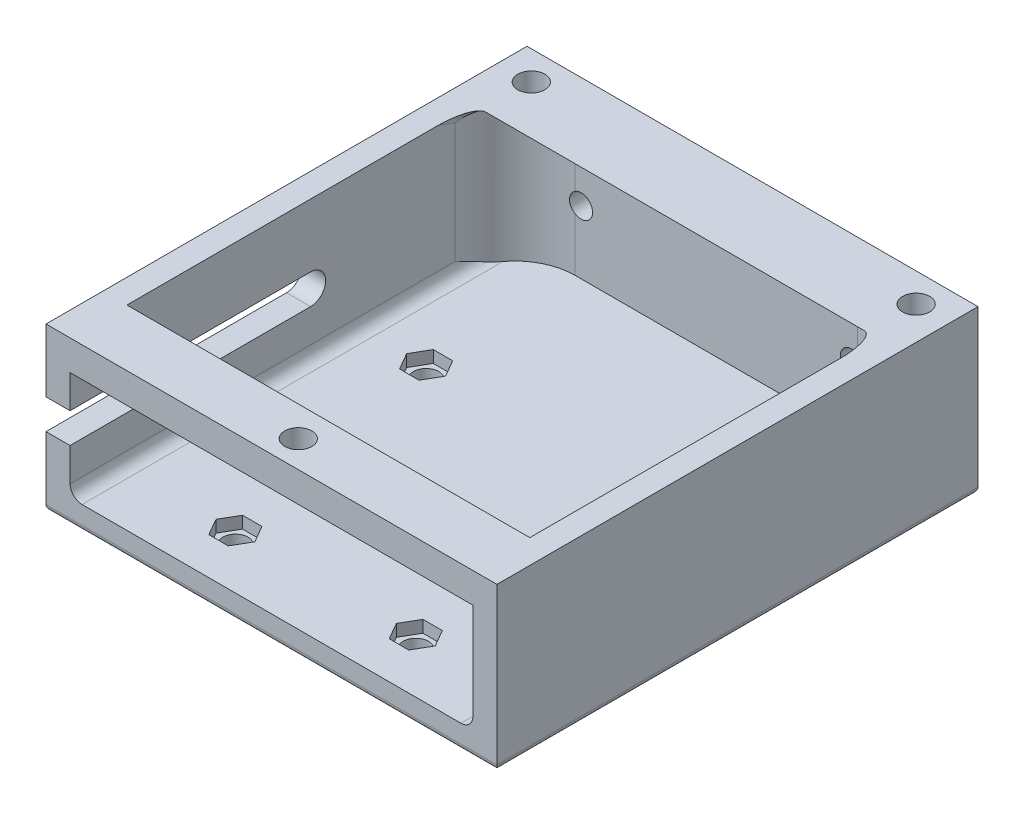
from build123d import *

# Parameters (mm, degrees)
EXTRUDE_1_DEPTH          = 37.5
SHELL_START              = -33.5
SHELL_1_DEPTH            = 67
FILLET_1_R               = 5
FILLET_3_R               = 2
FILLET_4_R               = 1
FILLET_5_R               = 10
CUT_EXTRUDE_2_DEPTH      = 94.307288118
CUT_EXTRUDE_2_DEPTH_BACK = 3
SKETCH_3_R               = 1.9
CUT_EXTRUDE_1_DEPTH      = 103.419810279
CUT_EXTRUDE_1_DEPTH_BACK = 103.419810279
SKETCH_2_W               = 80
SKETCH_2_H               = 35
SKETCH_5_R               = 2.25
CUT_EXTRUDE_4_DEPTH      = 8
CUT_EXTRUDE_5_DEPTH      = 88.242478302
CUT_EXTRUDE_5_DEPTH_BACK = 88.242478302
SKETCH_6_R               = 1.9
CUT_EXTRUDE_6_REACH      = 114.934
CUT_EXTRUDE_7_REACH      = 94.386
SKETCH_8_R               = 2.1
CUT_EXTRUDE_8_DEPTH      = 2


# Read off the part's stored shape, not the designer's step: 抽壳1
with BuildPart() as part:
    # 草图1 → 凸台-拉伸1 (new, symmetric)
    with BuildSketch(Plane(origin=(0, 0, 0), x_dir=(0, 0, -1), z_dir=(1, 0, 0))):
        Polygon((-70.540010176, 52.231309316), (-70.540010176, 30), (-80, 30), (-80, 0), (0, 0), (0, 30), (-9.459989824, 30), align=None)
    extrude(amount=EXTRUDE_1_DEPTH, both=True)

    # 抽壳1 outline → 抽壳1 (cut)
    with BuildSketch(Plane.YZ.offset(SHELL_START)):
        Polygon((47.974598226, 70.540010176), (22, 70.540010176), (22, 80), (4, 80), (4, 6), (24.483955603, 6), align=None)
    extrude(amount=SHELL_1_DEPTH, mode=Mode.SUBTRACT)

    # 圆角1
    fillet_1_edges = [part.edges().sort_by_distance(p)[0] for p in [
        (0, 30, 9.459989824),
        (35.5, 30, 70.540010176),
        (-35.5, 30, 70.540010176),
    ]]
    fillet(fillet_1_edges, radius=FILLET_1_R)

    # 圆角3
    fillet_3_edges = [part.edges().sort_by_distance(p)[0] for p in [
        (33.5, 4, 43),
        (33.5, 36.229276914, 38.270005088),
        (-33.5, 36.229276914, 38.270005088),
        (-33.5, 4, 43),
    ]]
    fillet(fillet_3_edges, radius=FILLET_3_R)

    # 圆角4
    fillet_4_edges = [part.edges().sort_by_distance(p)[0] for p in [
        (-37.5, 30, 4.28917746),
        (-37.5, 30.075961235, 9.446595809),
        (37.5, 30, 4.28917746),
        (37.5, 30.075961235, 9.446595809),
        (-37.5, 41.266423106, 40.414232907),
        (0, 52.231309316, 70.540010176),
        (37.5, 41.266423106, 40.414232907),
        (37.5, 0, 40),
        (-37.5, 0, 40),
        (0, 0, 80),
        (0, 0, 0),
        (0, 30, 0),
        (0, 30, 80),
    ]]
    fillet(fillet_4_edges, radius=FILLET_4_R)

    # 圆角5
    # the kernel refuses this fillet: 10 mm, written as the material it adds along each edge
    with BuildSketch(Plane(origin=(33.5, -19, 6), x_dir=(0, 0, 1), z_dir=(0, 1, 0))) as fillet_5_piece_1_section:
        with BuildLine():
            CenterArc((FILLET_5_R, -FILLET_5_R), FILLET_5_R, 90, 90)
            Line((0, -FILLET_5_R), (0, 0))
            Line((0, 0), (FILLET_5_R, 0))
        make_face()
    fillet_5_piece_1 = extrude(amount=66.355600058, mode=Mode.PRIVATE)
    fillet_5_piece_1 = split(fillet_5_piece_1, bisect_by=Plane(origin=(31.283756862, 30, 8.259643185), z_dir=(0, -1, 0)), keep=Keep.TOP, mode=Mode.PRIVATE)
    fillet_5_piece_1 = split(fillet_5_piece_1, bisect_by=Plane(origin=(31.283756862, 0, 8.259643185), z_dir=(0, 1, 0)), keep=Keep.TOP, mode=Mode.PRIVATE)
    add(fillet_5_piece_1)
    with BuildSketch(Plane(origin=(-33.5, -19, 6), x_dir=(0, 0, 1), z_dir=(0, 1, 0))) as fillet_5_piece_2_section:
        with BuildLine():
            CenterArc((FILLET_5_R, FILLET_5_R), FILLET_5_R, 180, 90)
            Line((0, FILLET_5_R), (0, 0))
            Line((0, 0), (FILLET_5_R, 0))
        make_face()
    fillet_5_piece_2 = extrude(amount=66.355600058, mode=Mode.PRIVATE)
    fillet_5_piece_2 = split(fillet_5_piece_2, bisect_by=Plane(origin=(-31.283756862, 30, 8.259643185), z_dir=(0, -1, 0)), keep=Keep.TOP, mode=Mode.PRIVATE)
    fillet_5_piece_2 = split(fillet_5_piece_2, bisect_by=Plane(origin=(-31.283756862, 0, 8.259643185), z_dir=(0, 1, 0)), keep=Keep.TOP, mode=Mode.PRIVATE)
    add(fillet_5_piece_2)

    # 草图3 → 切除-拉伸2 (cut, two sides: drawn at the far end of the back side and taken through both)
    with BuildSketch(Plane(origin=(0, 30, 0), x_dir=(1, 0, 0), z_dir=(0, 1, 0)).offset(-CUT_EXTRUDE_2_DEPTH_BACK)):
        with Locations(Location((-32, -4.78917746, 0), (0, 0, 90))):
            Circle(SKETCH_3_R)
        with Locations(Location((32, -4.78917746, 0), (0, 0, 90))):
            Circle(SKETCH_3_R)
        with Locations(Location((0, -75.540010176, 0), (0, 0, 90))):
            Circle(SKETCH_3_R)
    extrude(amount=CUT_EXTRUDE_2_DEPTH + CUT_EXTRUDE_2_DEPTH_BACK, mode=Mode.SUBTRACT)

    # 草图2 → 切除-拉伸1 (cut, two sides: drawn at the far end of the back side and taken through both)
    with BuildSketch(Plane(origin=(0, 0, 0), x_dir=(0, 0, -1), z_dir=(1, 0, 0)).offset(-CUT_EXTRUDE_1_DEPTH_BACK)):
        with Locations((-40, 44.5)):
            Rectangle(SKETCH_2_W, SKETCH_2_H)
    extrude(amount=CUT_EXTRUDE_1_DEPTH + CUT_EXTRUDE_1_DEPTH_BACK, mode=Mode.SUBTRACT)

    # 草图5 → 切除-拉伸4 (cut)
    with BuildSketch(Plane(origin=(0, 27, 0), x_dir=(1, 0, 0), z_dir=(0, 1, 0))):
        with Locations(Location((0, -75.540010176, 0), (0, 0, 270))):
            Circle(SKETCH_5_R)
        with Locations(Location((32, -4.78917746, 0), (0, 0, 270))):
            Circle(SKETCH_5_R)
        with Locations(Location((-32, -4.78917746, 0), (0, 0, 270))):
            Circle(SKETCH_5_R)
    extrude(amount=-CUT_EXTRUDE_4_DEPTH, mode=Mode.SUBTRACT)

    # 草图6 → 切除-拉伸5 (cut, two sides: drawn at the far end of the back side and taken through both)
    with BuildSketch(Plane.XY.offset(6).offset(-CUT_EXTRUDE_5_DEPTH_BACK)):
        with Locations((-22.5, 14.5)):
            Circle(SKETCH_6_R)
        with Locations((22.5, 14.5)):
            Circle(SKETCH_6_R)
    extrude(amount=CUT_EXTRUDE_5_DEPTH + CUT_EXTRUDE_5_DEPTH_BACK, mode=Mode.SUBTRACT)

    # 草图7 → 切除-拉伸6 (cut, up to next)
    with BuildSketch(Plane.ZY.offset(37.5), mode=Mode.PRIVATE) as cut_extrude_6_sk1:
        with BuildLine():
            Line((40, 16.5), (80, 16.5))
            ThreePointArc((80, 16.5), (82.5, 14), (80, 11.5))
            Line((80, 11.5), (40, 11.5))
            ThreePointArc((40, 11.5), (37.5, 14), (40, 16.5))
        make_face()
    cut_extrude_6_tool1 = extrude(cut_extrude_6_sk1.sketch, amount=-CUT_EXTRUDE_6_REACH, mode=Mode.PRIVATE) & part.part
    add(cut_extrude_6_tool1.solids().sort_by_distance((-37.5, 14, 60))[0], mode=Mode.SUBTRACT)

    # 草图8 → 切除-拉伸7 (cut, up to next)
    with BuildSketch(Plane.XZ, mode=Mode.PRIVATE) as cut_extrude_7_sk1:
        with Locations(Location((23, 31.28, 0), (0, 0, 270))):
            Circle(SKETCH_8_R)
    cut_extrude_7_tool1 = extrude(cut_extrude_7_sk1.sketch, amount=-CUT_EXTRUDE_7_REACH, mode=Mode.PRIVATE) & part.part
    # 草图8 → 切除-拉伸7 (cut, up to next)
    with BuildSketch(Plane.XZ, mode=Mode.PRIVATE) as cut_extrude_7_sk2:
        with Locations(Location((15, 71, 0), (0, 0, 270))):
            Circle(SKETCH_8_R)
    cut_extrude_7_tool2 = extrude(cut_extrude_7_sk2.sketch, amount=-CUT_EXTRUDE_7_REACH, mode=Mode.PRIVATE) & part.part
    # 草图8 → 切除-拉伸7 (cut, up to next)
    with BuildSketch(Plane.XZ, mode=Mode.PRIVATE) as cut_extrude_7_sk3:
        with Locations(Location((-15, 71, 0), (0, 0, 270))):
            Circle(SKETCH_8_R)
    cut_extrude_7_tool3 = extrude(cut_extrude_7_sk3.sketch, amount=-CUT_EXTRUDE_7_REACH, mode=Mode.PRIVATE) & part.part
    # 草图8 → 切除-拉伸7 (cut, up to next)
    with BuildSketch(Plane.XZ, mode=Mode.PRIVATE) as cut_extrude_7_sk4:
        with Locations(Location((-23, 31.28, 0), (0, 0, 270))):
            Circle(SKETCH_8_R)
    cut_extrude_7_tool4 = extrude(cut_extrude_7_sk4.sketch, amount=-CUT_EXTRUDE_7_REACH, mode=Mode.PRIVATE) & part.part
    add(cut_extrude_7_tool1.solids().sort_by_distance((23, 0, 31.28))[0], mode=Mode.SUBTRACT)
    add(cut_extrude_7_tool2.solids().sort_by_distance((15, 0, 71))[0], mode=Mode.SUBTRACT)
    add(cut_extrude_7_tool3.solids().sort_by_distance((-15, 0, 71))[0], mode=Mode.SUBTRACT)
    add(cut_extrude_7_tool4.solids().sort_by_distance((-23, 0, 31.28))[0], mode=Mode.SUBTRACT)

    # 草图9 → 切除-拉伸8 (cut)
    with BuildSketch(Plane(origin=(0, 4, 0), x_dir=(1, 0, 0), z_dir=(0, 1, 0))):
        Polygon((18.233161507, -71), (16.616580754, -68.2), (13.383419246, -68.2), (11.766838493, -71), (13.383419246, -73.8), (16.616580754, -73.8), align=None)
        Polygon((-11.766838493, -71), (-13.383419246, -68.2), (-16.616580754, -68.2), (-18.233161507, -71), (-16.616580754, -73.8), (-13.383419246, -73.8), align=None)
        Polygon((26.233161507, -31.28), (24.616580754, -28.48), (21.383419246, -28.48), (19.766838493, -31.28), (21.383419246, -34.08), (24.616580754, -34.08), align=None)
        Polygon((-26.233161507, -31.28), (-24.616580754, -34.08), (-21.383419246, -34.08), (-19.766838493, -31.28), (-21.383419246, -28.48), (-24.616580754, -28.48), align=None)
    extrude(amount=-CUT_EXTRUDE_8_DEPTH, mode=Mode.SUBTRACT)


solid = part.part
